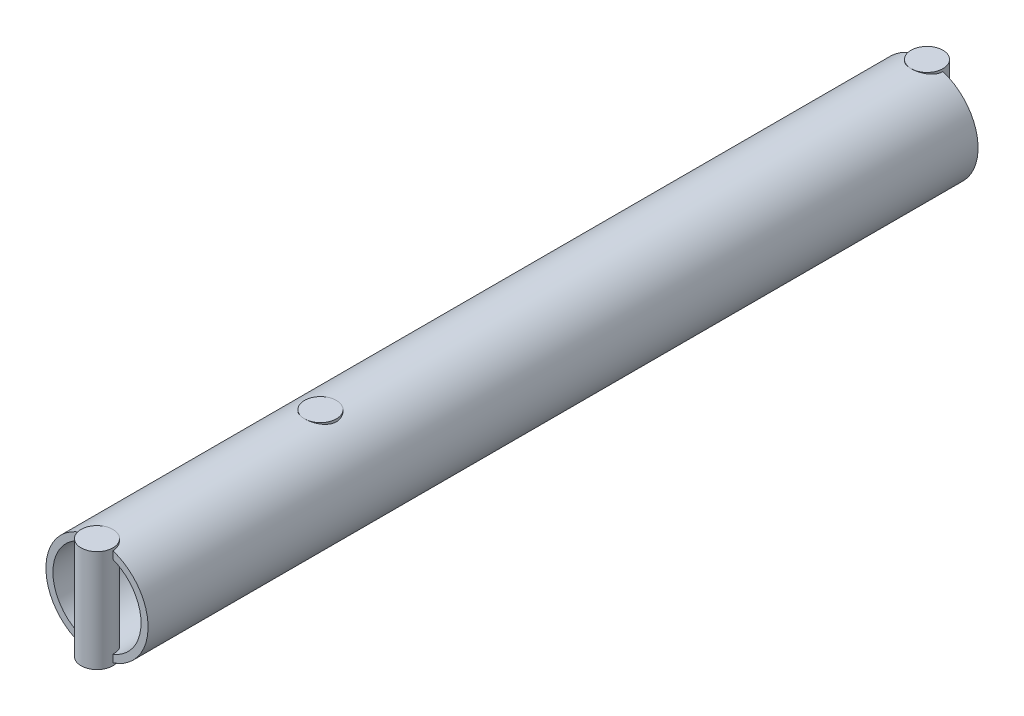
from build123d import *
from build123d.topology import SkipClean

# Parameters (mm, degrees)
SKETCH1_R                = 8
SKETCH1_R_2              = 6.9
BOSS_EXTRUDE1_DEPTH      = 130
BOSS_EXTRUDE2_DEPTH      = 8
BOSS_EXTRUDE2_DEPTH_BACK = 8
SKETCH2_R                = 2.5


with BuildPart() as part:
    # Sketch1 → Boss-Extrude1 (new body)
    with BuildSketch(Plane.XY):
        Circle(SKETCH1_R)
        Circle(SKETCH1_R_2, mode=Mode.SUBTRACT)
    extrude(amount=BOSS_EXTRUDE1_DEPTH)

    # Sketch2 → Boss-Extrude2 (add, two sides: drawn at the far end of the back side and taken through both)
    with SkipClean():  # the faces are left unmerged after this step: merging them gives an invalid solid
        with BuildSketch(Plane(origin=(0, 0, 0), x_dir=(1, 0, 0), z_dir=(0, 1, 0)).offset(-BOSS_EXTRUDE2_DEPTH_BACK)):
            Circle(SKETCH2_R)
            with Locations((0, -130)):
                Circle(SKETCH2_R)
            with Locations((0, -95)):
                Circle(SKETCH2_R)
        extrude(amount=BOSS_EXTRUDE2_DEPTH + BOSS_EXTRUDE2_DEPTH_BACK)


solid = part.part
